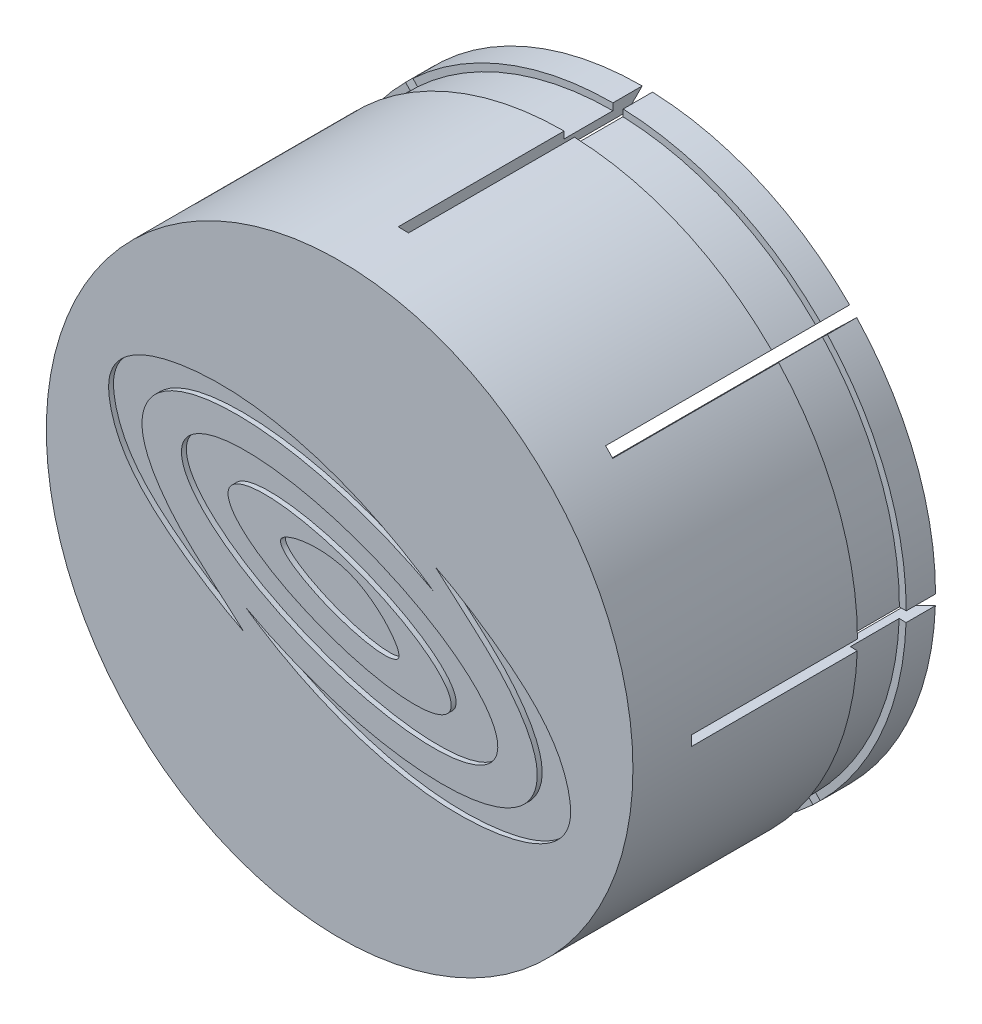
from build123d import *
from build123d.topology import SkipClean

# Parameters (mm, degrees)
SKETCH1_R           = 30.05
SKETCH1_R_2         = 28.55
BOSS_EXTRUDE1_DEPTH = 3
BOSS_EXTRUDE2_START = -3
SKETCH1_3_R         = 30.05
SKETCH1_3_R_2       = 28.55
BOSS_EXTRUDE2_DEPTH = 3
BOSS_EXTRUDE3_START = 25
BOSS_EXTRUDE3_DEPTH = 25
SKETCH4_W           = 0.7
SKETCH4_H           = 5
CUT_EXTRUDE1_START  = -0.5
CUT_EXTRUDE1_DEPTH  = 0.5


# Read off the part's stored shape, not the designer's step: Cut-Extrude1
with BuildPart() as part:
    # Sketch1 → Boss-Extrude1 (new body)
    # profile 1 of 2: a face of its own
    with BuildSketch(Plane.XY):
        Circle(SKETCH1_R)
        Circle(SKETCH1_R_2, mode=Mode.SUBTRACT)
    # profile 2 of 2: a face of its own
    with BuildSketch(Plane.XY):
        Circle(SKETCH1_R_2)
    extrude(amount=BOSS_EXTRUDE1_DEPTH)

    # Sketch1<3> → Boss-Extrude2 (add)
    with BuildSketch(Plane.XY.offset(BOSS_EXTRUDE2_START)):
        Circle(SKETCH1_3_R)
        Circle(SKETCH1_3_R_2, mode=Mode.SUBTRACT)
    extrude(amount=BOSS_EXTRUDE2_DEPTH)

    # Sketch3 → Boss-Extrude3 (add)
    with SkipClean():  # the faces are left unmerged after this step: merging them gives an invalid solid
        with BuildSketch(Plane(origin=(0, 0, -3), x_dir=(-1, 0, 0), z_dir=(0, 0, -1)).offset(BOSS_EXTRUDE3_START)):
            with BuildLine():
                Line((20.491380882, 21.979668094), (19.468516612, 20.882513281))
                ThreePointArc((19.468516612, 20.882513281), (10.461996603, 26.564057052), (0, 28.55))
                Line((0, 28.55), (0, 30.05))
                ThreePointArc((0, 30.05), (11.011663675, 27.959716793), (20.491380882, 21.979668094))
            make_face()
            with BuildLine():
                Line((30.031566735, 1.05237798), (28.532486865, 0.999846633))
                ThreePointArc((28.532486865, 0.999846633), (26.18137362, 11.385876135), (20.187898603, 20.187898603))
                Line((20.187898603, 20.187898603), (21.248558775, 21.248558775))
                ThreePointArc((21.248558775, 21.248558775), (27.5569274, 11.984083288), (30.031566735, 1.05237798))
            make_face()
            with BuildLine():
                Line((21.979668094, -20.491380882), (20.882513281, -19.468516612))
                ThreePointArc((20.882513281, -19.468516612), (26.564057052, -10.461996603), (28.55, 0))
                Line((28.55, 0), (30.05, 0))
                ThreePointArc((30.05, 0), (27.959716793, -11.011663675), (21.979668094, -20.491380882))
            make_face()
            with BuildLine():
                Line((1.05237798, -30.031566735), (0.999846633, -28.532486865))
                ThreePointArc((0.999846633, -28.532486865), (11.385876135, -26.18137362), (20.187898603, -20.187898603))
                Line((20.187898603, -20.187898603), (21.248558775, -21.248558775))
                ThreePointArc((21.248558775, -21.248558775), (11.984083288, -27.5569274), (1.05237798, -30.031566735))
            make_face()
            with BuildLine():
                Line((-20.491380882, -21.979668094), (-19.468516612, -20.882513281))
                ThreePointArc((-19.468516612, -20.882513281), (-10.461996603, -26.564057052), (0, -28.55))
                Line((0, -28.55), (0, -30.05))
                ThreePointArc((0, -30.05), (-11.011663675, -27.959716793), (-20.491380882, -21.979668094))
            make_face()
            with BuildLine():
                Line((-30.031566735, -1.05237798), (-28.532486865, -0.999846633))
                ThreePointArc((-28.532486865, -0.999846633), (-26.18137362, -11.385876135), (-20.187898603, -20.187898603))
                Line((-20.187898603, -20.187898603), (-21.248558775, -21.248558775))
                ThreePointArc((-21.248558775, -21.248558775), (-27.5569274, -11.984083288), (-30.031566735, -1.05237798))
            make_face()
            with BuildLine():
                Line((-21.979668094, 20.491380882), (-20.882513281, 19.468516612))
                ThreePointArc((-20.882513281, 19.468516612), (-26.564057052, 10.461996603), (-28.55, 0))
                Line((-28.55, 0), (-30.05, 0))
                ThreePointArc((-30.05, 0), (-27.959716793, 11.011663675), (-21.979668094, 20.491380882))
            make_face()
            with BuildLine():
                Line((-1.05237798, 30.031566735), (-0.999846633, 28.532486865))
                ThreePointArc((-0.999846633, 28.532486865), (-11.385876135, 26.18137362), (-20.187898603, 20.187898603))
                Line((-20.187898603, 20.187898603), (-21.248558775, 21.248558775))
                ThreePointArc((-21.248558775, 21.248558775), (-11.984083288, 27.5569274), (-1.05237798, 30.031566735))
            make_face()
        extrude(amount=-BOSS_EXTRUDE3_DEPTH)

    # Sketch4 → Cut-Revolve1 (revolve, cut)
    with SkipClean():  # the faces are left unmerged after this step: merging them gives an invalid solid
        with BuildSketch(Plane(origin=(0, 0, 0), x_dir=(1, 0, 0), z_dir=(0, 1, 0))):
            with Locations((29.7, 22.5)):
                Rectangle(SKETCH4_W, SKETCH4_H)
            Polygon((28.55, 26.5), (28.55, 28), (30.05, 28), align=None)
        revolve(axis=Axis((0, 0, 3), (0, 0, -1)), mode=Mode.SUBTRACT)

    # Cut-Extrude1 outline → Cut-Extrude1 (cut)
    # profile 1 of 4: a face of its own
    with SkipClean():  # the faces are left unmerged after this step: merging them gives an invalid solid
        with BuildSketch(Plane.XY.offset(3).offset(CUT_EXTRUDE1_START)):
            with BuildLine():
                add(Edge.make_bspline(
                    [(-9.831188481, -7.76286267), (-12.31509908, -6.564453694), (-19.945506052, -1.751090116), (-23.245520708, 3.604062551), (-24.465440518, 11.416266415), (-15.133909058, 13.3540246), (-0.220085461, 12.125105625), (7.518774259, 6.992670667), (9.641745648, 5.518604803)],
                    knots=[0, 0, 0, 0, 0.123562004, 0.211727559, 0.248485922, 0.454387264, 0.532112439, 1, 1, 1, 1], degree=3))
                add(Edge.make_bspline(
                    [(-9.831188481, -7.76286267), (-14.608290319, -3.536611009), (-17.897696817, -0.898578419), (-21.378258226, 5.519092244), (-19.304554183, 8.268748828)],
                    knots=[0, 0, 0, 0, 0.497115956, 0.99999998, 0.99999998, 0.99999998, 0.99999998], degree=3))
                add(Edge.make_bspline(
                    [(9.641745648, 5.518604803), (-12.302292658, 17.553494797), (-19.304554183, 8.268748828)],
                    knots=[1.224732712, 1.224732712, 1.224732712, 3.011762383, 3.011762383, 3.011762383], degree=2, weights=[1, 0.626676865, 1]))
            make_face()
        # profile 2 of 4: a face of its own
        with BuildSketch(Plane.XY.offset(3).offset(CUT_EXTRUDE1_START)):
            with BuildLine():
                add(Edge.make_bspline(
                    [(9.831188481, 7.76286267), (12.31509908, 6.564453694), (19.945506052, 1.751090116), (23.245520708, -3.604062551), (24.465440518, -11.416266415), (15.133909058, -13.3540246), (0.220085461, -12.125105625), (-7.518774259, -6.992670667), (-9.641745648, -5.518604803)],
                    knots=[0, 0, 0, 0, 0.123562004, 0.211727559, 0.248485922, 0.454387264, 0.532112439, 1, 1, 1, 1], degree=3))
                add(Edge.make_bspline(
                    [(9.831188481, 7.76286267), (14.608290319, 3.536611009), (17.897696883, 0.898578367), (21.378258365, -5.5190925), (19.304553936, -8.268749156)],
                    knots=[0, 0, 0, 0, 0.497115956, 1, 1, 1, 1], degree=3))
                add(Edge.make_bspline(
                    [(-9.641745648, -5.518604803), (12.302291673, -17.553494257), (19.304553936, -8.268749156)],
                    knots=[4.366325366, 4.366325366, 4.366325366, 6.153354993, 6.153354993, 6.153354993], degree=2, weights=[1, 0.626676882, 1]))
            make_face()
        # profile 3 of 4: a face of its own
        with BuildSketch(Plane.XY.offset(3).offset(CUT_EXTRUDE1_START)):
            with BuildLine():
                add(Edge.make_bspline(
                    [(-16.054779318, 5.843461789), (-19.839576992, -4.555184358), (6.134990822, -8.121053968), (32.109558636, -11.686923579), (9.919788496, 2.277592179), (-12.269981644, 16.242107937), (-16.054779318, 5.843461789)],
                    knots=[0, 0, 0, 2.094395102, 2.094395102, 4.188790205, 4.188790205, 6.283185307, 6.283185307, 6.283185307], degree=2, weights=[1, 0.5, 1, 0.5, 1, 0.5, 1]))
            make_face()
            with BuildLine():
                add(Edge.make_bspline(
                    [(-11.355964711, 4.133233136), (-13.640122053, -2.142437584), (4.535903685, -5.204451928), (22.711929422, -8.266466273), (6.820061027, 1.071218792), (-9.071807369, 10.408903856), (-11.355964711, 4.133233136)],
                    knots=[0, 0, 0, 2.094395102, 2.094395102, 4.188790205, 4.188790205, 6.283185307, 6.283185307, 6.283185307], degree=2, weights=[1, 0.5, 1, 0.5, 1, 0.5, 1]))
            make_face(mode=Mode.SUBTRACT)
        # profile 4 of 4: a face of its own
        with BuildSketch(Plane.XY.offset(3).offset(CUT_EXTRUDE1_START)):
            with BuildLine():
                add(Edge.make_bspline(
                    [(-0.545917498, -1.499895999), (1.967945144, -2.431945071), (5.077041498, -3.030895568), (6.737953902, -1.750447632), (1.605929106, 4.537470773), (-6.123195001, 3.076782229), (-6.04339485, 1.101123427), (-3.081000207, -0.559979297), (-0.545917498, -1.499895999)],
                    knots=[0, 0, 0, 0, 0.245515964, 0.295417536, 0.499015724, 0.702313155, 0.752411582, 1, 1, 1, 1], degree=3))
            make_face()
        extrude(amount=CUT_EXTRUDE1_DEPTH, mode=Mode.SUBTRACT)


solid = part.part
